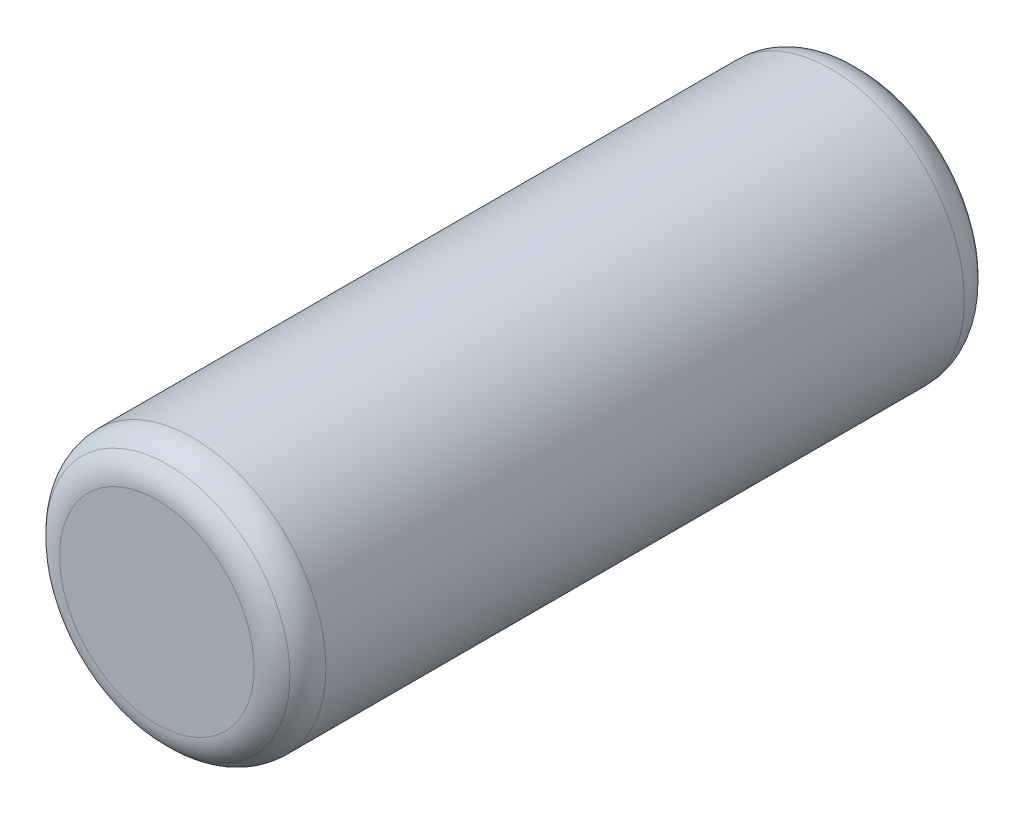
from build123d import *

# Parameters (mm, degrees)
SKETCH2_R           = 3
BOSS_EXTRUDE1_DEPTH = 15.5
SKETCH5_R           = 2.75
BOSS_EXTRUDE2_DEPTH = 0.25
FILLET3_R           = 0.75
SKETCH6_R           = 2.75
BOSS_EXTRUDE3_DEPTH = 0.25
FILLET4_R           = 0.75


with BuildPart() as part:
    # Sketch2 → Boss-Extrude1 (new body)
    with BuildSketch(Plane.XY):
        Circle(SKETCH2_R)
    extrude(amount=-BOSS_EXTRUDE1_DEPTH)

    # Sketch5 → Boss-Extrude2 (add)
    with BuildSketch(Plane.XY):
        Circle(SKETCH5_R)
    extrude(amount=BOSS_EXTRUDE2_DEPTH)

    # Fillet3
    # the kernel refuses this fillet: 0.75 mm, written as the material it takes off along each edge
    with BuildSketch(Plane(origin=(0, 0, 0), x_dir=(1, 0, 0), z_dir=(0, -1, 0))) as fillet3_piece_1:
        with BuildLine():
            CenterArc((2.25, -0.559016994), FILLET3_R, 0, 48.189685104)
            Line((2.75, 0), (2.76, 0.01118034))
            ThreePointArc((2.76, 0.01118034), (2.875, 0.015), (3, 0.015))
            Line((3, 0.015), (3.015, 0))
            Line((3.015, 0), (3.015, -0.559016994))
            Line((3.015, -0.559016994), (3, -0.559016994))
        make_face()
    revolve(axis=Axis((0, 0, 0), (0, 0, 1)), mode=Mode.SUBTRACT)
    with BuildSketch(Plane(origin=(0, 0, 0.25), x_dir=(1, 0, 0), z_dir=(0, -1, 0))) as fillet3_piece_2:
        with BuildLine():
            CenterArc((2.190983006, -0.75), FILLET3_R, 41.810314896, 48.189685104)
            Line((2.190983006, 0), (2.190983006, 0.015))
            Line((2.190983006, 0.015), (2.75, 0.015))
            Line((2.75, 0.015), (2.765, 0))
            ThreePointArc((2.765, 0), (2.765, -0.125), (2.76118034, -0.24))
            Line((2.76118034, -0.24), (2.75, -0.25))
        make_face()
    revolve(axis=Axis((0, 0, 0.25), (0, 0, 1)), mode=Mode.SUBTRACT)

    # Sketch6 → Boss-Extrude3 (add)
    with BuildSketch(Plane(origin=(0, 0, -15.5), x_dir=(-1, 0, 0), z_dir=(0, 0, -1))):
        Circle(SKETCH6_R)
    extrude(amount=BOSS_EXTRUDE3_DEPTH)

    # Fillet4
    # the kernel refuses this fillet: 0.75 mm, written as the material it takes off along each edge
    with BuildSketch(Plane(origin=(0, 0, -15.75), x_dir=(-1, 0, 0), z_dir=(0, -1, 0))) as fillet4_piece_1:
        with BuildLine():
            CenterArc((2.190983006, -0.75), FILLET4_R, 41.810314896, 48.189685104)
            Line((2.190983006, 0), (2.190983006, 0.015))
            Line((2.190983006, 0.015), (2.75, 0.015))
            Line((2.75, 0.015), (2.765, 0))
            ThreePointArc((2.765, 0), (2.765, -0.125), (2.76118034, -0.24))
            Line((2.76118034, -0.24), (2.75, -0.25))
        make_face()
    revolve(axis=Axis((0, 0, -15.75), (0, 0, -1)), mode=Mode.SUBTRACT)
    with BuildSketch(Plane(origin=(0, 0, -15.5), x_dir=(1, 0, 0), z_dir=(0, -1, 0))) as fillet4_piece_2:
        with BuildLine():
            CenterArc((2.25, 0.559016994), FILLET4_R, 311.810314896, 48.189685104)
            Line((2.75, 0), (2.76, -0.01118034))
            ThreePointArc((2.76, -0.01118034), (2.875, -0.015), (3, -0.015))
            Line((3, -0.015), (3.015, 0))
            Line((3.015, 0), (3.015, 0.559016994))
            Line((3.015, 0.559016994), (3, 0.559016994))
        make_face()
    revolve(axis=Axis((0, 0, -15.5), (0, 0, 1)), mode=Mode.SUBTRACT)


solid = part.part
